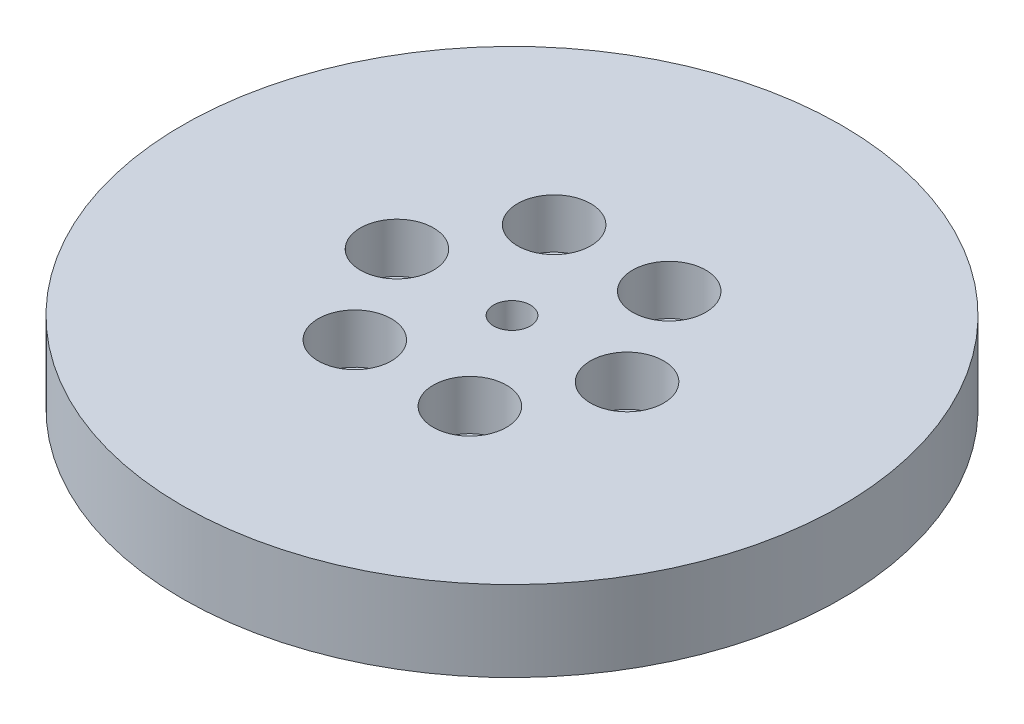
from build123d import *

# Parameters (mm, degrees)
SKETCH1_R           = 90
BOSS_EXTRUDE1_DEPTH = 22
SKETCH2_R           = 5
CUT_EXTRUDE1_DEPTH  = 130.16655914
SKETCH3_R           = 10
CUT_EXTRUDE2_DEPTH  = 13.552440868
CIRPATTERN1_COUNT   = 6


with BuildPart() as part:
    # Sketch1 → Boss-Extrude1 (new body)
    with BuildSketch(Plane(origin=(0, 0, 0), x_dir=(1, 0, 0), z_dir=(0, 1, 0))):
        Circle(SKETCH1_R)
    extrude(amount=BOSS_EXTRUDE1_DEPTH)

    # Sketch2 → Cut-Extrude1 (cut, through all)
    with BuildSketch(Plane(origin=(0, 0, 0), x_dir=(1, 0, 0), z_dir=(0, 1, 0))):
        Circle(SKETCH2_R)
    extrude(amount=CUT_EXTRUDE1_DEPTH, mode=Mode.SUBTRACT)

    # Sketch3 → Cut-Extrude2 (cut)
    with BuildSketch(Plane(origin=(0, 22, 0), x_dir=(1, 0, 0), z_dir=(0, 1, 0))):
        with Locations((-31.427537015, 0)):
            Circle(SKETCH3_R)
    cut_extrude2 = extrude(amount=-CUT_EXTRUDE2_DEPTH, mode=Mode.SUBTRACT)

    # CirPattern1: Cut-Extrude2 ×6 about axis
    cirpattern1_axis = Axis((0, 0, 0), (0, 1, 0))
    for i in range(1, CIRPATTERN1_COUNT):
        add(cut_extrude2.rotate(cirpattern1_axis, i * 360 / CIRPATTERN1_COUNT), mode=Mode.SUBTRACT)


solid = part.part
